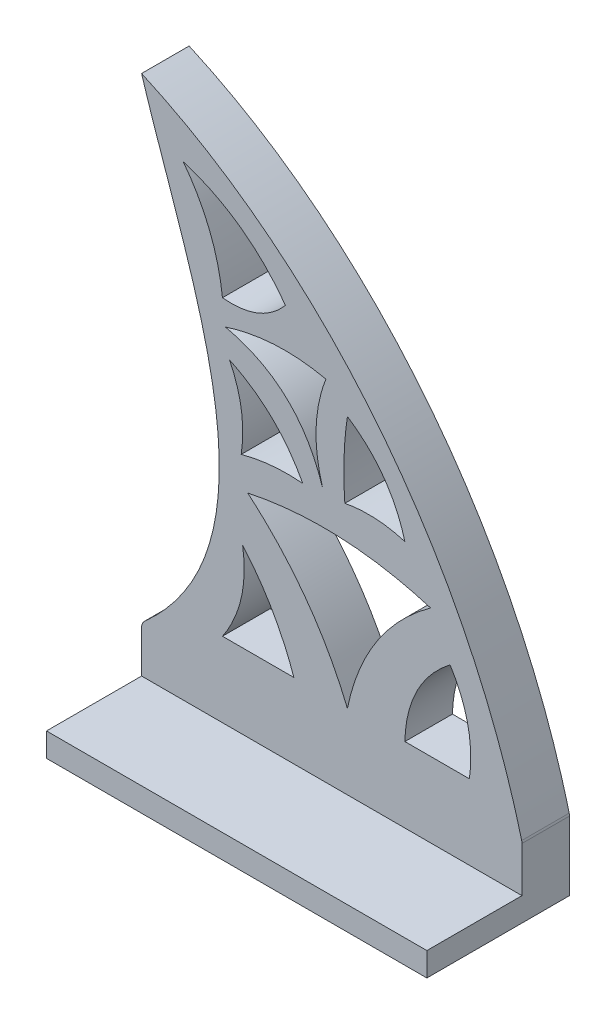
from build123d import *

# Parameters (mm, degrees)
SKETCH1_W           = 101.6
SKETCH1_H           = 152.4
BOSS_EXTRUDE1_DEPTH = 12.7
BOSS_EXTRUDE3_DEPTH = 12.7
FILLET1_R           = 2.54
FILLET2_R           = 5.08
CUT_EXTRUDE2_DEPTH  = 298.570512784
SKETCH8_W           = 101.6
SKETCH8_H           = 6.35
BOSS_EXTRUDE4_DEPTH = 25.4


with BuildPart() as part:
    # Sketch1 → Boss-Extrude1 (new body)
    with BuildSketch(Plane.XY):
        with Locations((50.8, 76.2)):
            Rectangle(SKETCH1_W, SKETCH1_H)
    extrude(amount=BOSS_EXTRUDE1_DEPTH)

    # Sketch2 → Boss-Extrude3 (add)
    with BuildSketch(Plane.XY):
        with BuildLine():
            add(Edge.make_bspline(
                [(0, 152.4), (39.790111277, 186.839065643), (12.30975625, 238.845497073), (0, 279.4)],
                knots=[0, 0, 0, 0, 1, 1, 1, 1], degree=3))
            Line((0, 152.4), (101.6, 152.4))
            add(Edge.make_bspline(
                [(0, 279.4), (51.286050257, 256.550041835), (87.836892382, 205.957944637), (101.6, 152.4)],
                knots=[0, 0, 0, 0, 1, 1, 1, 1], degree=3))
        make_face()
        with BuildLine():
            add(Edge.make_bspline(
                [(26.980466376, 183.81374211), (36.13847285, 173.175056715), (40.676641776, 160.02)],
                knots=[0, 0, 0, 1, 1, 1], degree=2))
            Line((40.676641776, 160.02), (21.602944743, 160.02))
            add(Edge.make_bspline(
                [(26.980466376, 183.81374211), (28.958775605, 170.837543608), (21.602944743, 160.02)],
                knots=[0, 0, 0, 1, 1, 1], degree=2))
        make_face(mode=Mode.SUBTRACT)
        with BuildLine():
            add(Edge.make_bspline(
                [(23.516066372, 224.861937296), (28.235295407, 215.21927262), (26.605728117, 204.582177714)],
                knots=[0, 0, 0, 1, 1, 1], degree=2))
            add(Edge.make_bspline(
                [(43.05348098, 206.08803494), (36.239789994, 218.91266054), (23.516066372, 224.861937296)],
                knots=[0, 0, 0, 1, 1, 1], degree=2))
            add(Edge.make_bspline(
                [(26.605728117, 204.582177714), (34.700432609, 206.792891754), (43.05348098, 206.08803494)],
                knots=[0, 0, 0, 1, 1, 1], degree=2))
        make_face(mode=Mode.SUBTRACT)
        with BuildLine():
            add(Edge.make_bspline(
                [(54.97708308, 160.02), (59.374728895, 181.400643158), (77.187204495, 194.363538628)],
                knots=[0, 0, 0, 1, 1, 1], degree=2))
            add(Edge.make_bspline(
                [(54.97708308, 160.02), (46.08347584, 181.54755316), (28.342136903, 196.529802482)],
                knots=[0, 0, 0, 1, 1, 1], degree=2))
            add(Edge.make_bspline(
                [(28.342136903, 196.529802482), (53.017815002, 201.732288521), (77.187204495, 194.363538628)],
                knots=[0, 0, 0, 1, 1, 1], degree=2))
        make_face(mode=Mode.SUBTRACT)
        with BuildLine():
            Line((87.546521436, 160.02), (70.32777317, 160.02))
            add(Edge.make_bspline(
                [(82.396089655, 183.81371778), (70.6713649, 174.663598784), (70.32777317, 160.02)],
                knots=[0, 0, 0, 1, 1, 1], degree=2))
            add(Edge.make_bspline(
                [(82.396089655, 183.81371778), (89.339550367, 172.773814043), (87.546521436, 160.02)],
                knots=[0, 0, 0, 1, 1, 1], degree=2))
        make_face(mode=Mode.SUBTRACT)
        with BuildLine():
            add(Edge.make_bspline(
                [(48.400350721, 207.535437601), (44.393568943, 220.734513873), (49.225838487, 233.315766274)],
                knots=[0, 0, 0, 1, 1, 1], degree=2))
            add(Edge.make_bspline(
                [(48.400350721, 207.535437601), (42.054170901, 227.566198031), (22.375615267, 231.937259722)],
                knots=[0, 0, 0, 1, 1, 1], degree=2))
            add(Edge.make_bspline(
                [(49.225838487, 233.315766274), (35.641228944, 236.267866949), (22.375615267, 231.937259722)],
                knots=[0, 0, 0, 1, 1, 1], degree=2))
        make_face(mode=Mode.SUBTRACT)
        with BuildLine():
            add(Edge.make_bspline(
                [(21.602944743, 238.323137826), (31.864782779, 237.284469605), (38.412267282, 244.949944056)],
                knots=[0, 0, 0, 1, 1, 1], degree=2))
            add(Edge.make_bspline(
                [(21.602944743, 238.323137826), (19.95197567, 252.974545225), (11.094737768, 264.601494061)],
                knots=[0, 0, 0, 1, 1, 1], degree=2))
            add(Edge.make_bspline(
                [(11.094737768, 264.601494061), (28.053835186, 259.295838115), (38.412267282, 244.949944056)],
                knots=[0, 0, 0, 1, 1, 1], degree=2))
        make_face(mode=Mode.SUBTRACT)
        with BuildLine():
            add(Edge.make_bspline(
                [(54.287141362, 207.109917469), (53.482096811, 217.391663167), (54.97708308, 227.557269012)],
                knots=[0, 0, 0, 1, 1, 1], degree=2))
            add(Edge.make_bspline(
                [(54.97708308, 227.557269012), (66.645859754, 219.852180834), (70.328259561, 206.277457578)],
                knots=[0, 0, 0, 1, 1, 1], degree=2))
            add(Edge.make_bspline(
                [(70.328259561, 206.277457578), (62.361576962, 208.669014941), (54.287141362, 207.109917469)],
                knots=[0, 0, 0, 1, 1, 1], degree=2))
        make_face(mode=Mode.SUBTRACT)
    extrude(amount=BOSS_EXTRUDE3_DEPTH)

    # Fillet1
    fillet1_edges = [part.edges().sort_by_distance(p)[0] for p in [
        (101.6, 152.4, 6.35),
        (0, 152.4, 6.35),
    ]]
    fillet(fillet1_edges, radius=FILLET1_R)

    # Fillet2
    fillet2_edges = [part.edges().sort_by_distance(p)[0] for p in [
        (101.6, 0, 6.35),
        (0, 0, 6.35),
    ]]
    fillet(fillet2_edges, radius=FILLET2_R)

    # Sketch5 → Cut-Extrude2 (cut, through all)
    with BuildSketch(Plane.XY.offset(12.7)):
        with BuildLine():
            Line((101.6, 133.663922723), (101.519048921, 133.663922723))
            Line((101.519048921, 133.663922723), (0, 133.663922723))
            Line((0, 133.663922723), (0, 5.08))
            ThreePointArc((0, 5.08), (1.487897552, 1.487897552), (5.08, 0))
            Line((5.08, 0), (96.52, 0))
            ThreePointArc((96.52, 0), (100.112102448, 1.487897552), (101.6, 5.08))
            Line((101.6, 5.08), (101.6, 133.663922723))
        make_face()
    extrude(amount=-CUT_EXTRUDE2_DEPTH, mode=Mode.SUBTRACT)

    # Sketch8 → Boss-Extrude4 (add)
    with BuildSketch(Plane.XY.offset(12.7)):
        with Locations((50.8, 136.838922723)):
            Rectangle(SKETCH8_W, SKETCH8_H)
    extrude(amount=BOSS_EXTRUDE4_DEPTH)


solid = part.part
